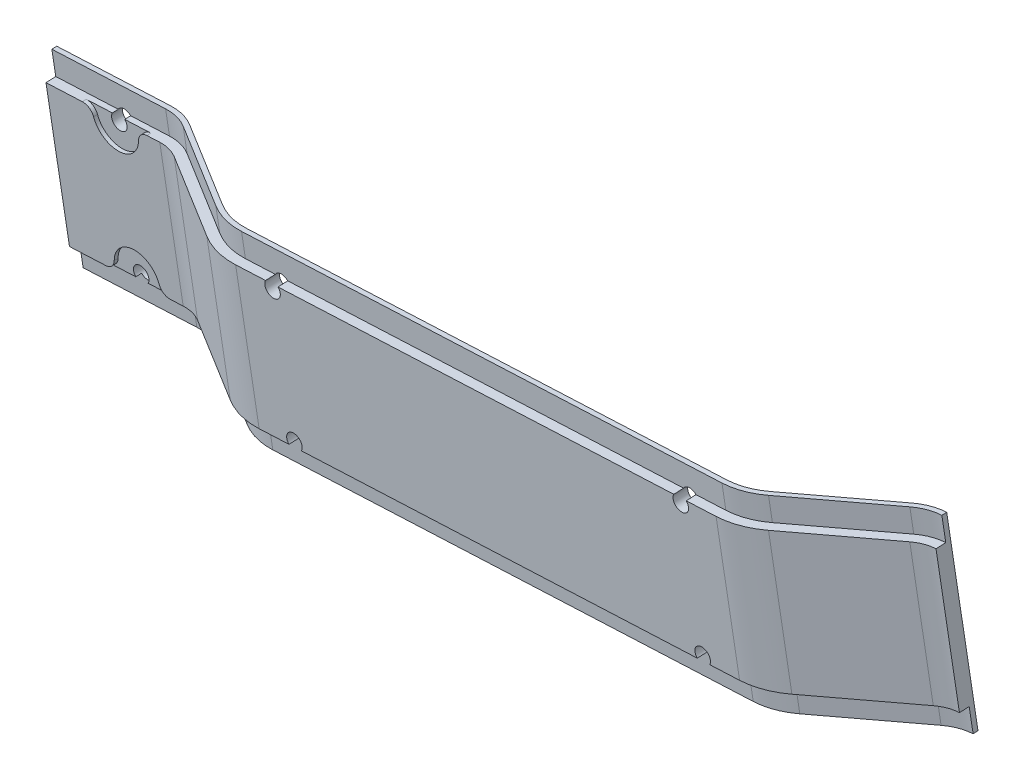
from build123d import *

# Parameters (mm, degrees)
EXTRUDE_1_DEPTH          = 40
CUT_EXTRUDE_1_DEPTH      = 5
SKETCH_5_R               = 1.7
CUT_EXTRUDE_2_DEPTH      = 10
SKETCH_6_R               = 1.7
CUT_EXTRUDE_3_DEPTH      = 55
CUT_EXTRUDE_4_DEPTH      = 0.8
EXTRUDE_2_DEPTH          = 2.5
EXTRUDE_3_DEPTH          = 2.5
MIRROR_3_COPY_1_DEPTH    = 5
MIRROR_3_COPY_2_SKETCH_R = 1.7
MIRROR_3_COPY_2_DEPTH    = 10
MIRROR_3_COPY_3_SKETCH_R = 1.7
MIRROR_3_COPY_3_DEPTH    = 55
MIRROR_3_COPY_4_DEPTH    = 0.8
CUT_EXTRUDE_5_DEPTH      = 67.5
FILLET_1_R               = 2.2


with BuildPart() as part:
    # 草图2 → 凸台-拉伸1 (new body)
    with BuildSketch(Plane(origin=(-35.952826641, 399.742426838, 30.566209897), x_dir=(0.9960030029050828, 0.08905977205298463, 0.006809934355634681), z_dir=(-0.0893197525973826, 0.9931039643902263, 0.07593745919082848))):
        with BuildLine():
            Line((491.263498397, -1135.802558188), (472.386322368, -1123.995822535))
            ThreePointArc((472.386322368, -1123.995822535), (468.823787584, -1122.370484391), (464.961974763, -1121.722580153))
            Line((464.961974763, -1121.722580153), (358.524587644, -1117.9611899))
            ThreePointArc((358.524587644, -1117.9611899), (354.626672948, -1118.33487317), (350.95829282, -1119.704678051))
            Line((350.95829282, -1119.704678051), (331.294771795, -1130.149424217))
            ThreePointArc((331.294771795, -1130.149424217), (328.360067693, -1131.245268121), (325.241735936, -1131.544214737))
            Line((325.241735936, -1131.544214737), (302.539273232, -1130.741932529))
            Line((302.539273232, -1130.741932529), (302.645224079, -1127.743804043))
            Line((302.645224079, -1127.743804043), (325.347686782, -1128.546086251))
            ThreePointArc((325.347686782, -1128.546086251), (327.6864356, -1128.321876289), (329.887463677, -1127.499993361))
            Line((329.887463677, -1127.499993361), (349.550984702, -1117.055247195))
            ThreePointArc((349.550984702, -1117.055247195), (353.953040855, -1115.411481338), (358.630538491, -1114.963061414))
            Line((358.630538491, -1114.963061414), (465.067925609, -1118.724451667))
            ThreePointArc((465.067925609, -1118.724451667), (469.702100995, -1119.501936753), (473.977142736, -1121.452342526))
            Line((473.977142736, -1121.452342526), (492.854318764, -1133.259078179))
            ThreePointArc((492.854318764, -1133.259078179), (494.991839635, -1134.234281065), (497.308927327, -1134.623023608))
            Line((497.308927327, -1134.623023608), (497.202976481, -1137.621152094))
            ThreePointArc((497.202976481, -1137.621152094), (494.113526224, -1137.102828703), (491.263498397, -1135.802558188))
        make_face()
    extrude_1 = extrude(amount=-EXTRUDE_1_DEPTH)

    # 草图3 → 切除-拉伸1 (cut)
    with BuildSketch(Plane(origin=(-35.952826641, 399.742426838, 30.566209897), x_dir=(0.9960030029050828, 0.08905977205298465, 0.0068099343556346816), z_dir=(-0.08931975259738263, 0.9931039643902263, 0.07593745919082849))):
        with BuildLine():
            Line((472.916595824, -1123.147995866), (491.793771852, -1134.954731518))
            ThreePointArc((491.793771852, -1134.954731518), (494.406297361, -1136.146646157), (497.23829343, -1136.621775932))
            Line((497.23829343, -1136.621775932), (497.308927327, -1134.623023608))
            ThreePointArc((497.308927327, -1134.623023608), (494.991839635, -1134.234281065), (492.854318764, -1133.259078179))
            Line((492.854318764, -1133.259078179), (473.977142736, -1121.452342526))
            ThreePointArc((473.977142736, -1121.452342526), (469.702100995, -1119.501936753), (465.067925609, -1118.724451667))
            Line((465.067925609, -1118.724451667), (358.630538491, -1114.963061414))
            ThreePointArc((358.630538491, -1114.963061414), (353.953040855, -1115.411481338), (349.550984702, -1117.055247195))
            Line((349.550984702, -1117.055247195), (329.887463677, -1127.499993361))
            ThreePointArc((329.887463677, -1127.499993361), (327.6864356, -1128.321876289), (325.347686782, -1128.546086251))
            Line((325.347686782, -1128.546086251), (302.645224079, -1127.743804043))
            Line((302.645224079, -1127.743804043), (302.574590181, -1129.742556367))
            Line((302.574590181, -1129.742556367), (325.277052884, -1130.544838575))
            ThreePointArc((325.277052884, -1130.544838575), (328.135523662, -1130.270804177), (330.825669089, -1129.266280598))
            Line((330.825669089, -1129.266280598), (350.489190114, -1118.821534432))
            ThreePointArc((350.489190114, -1118.821534432), (354.402128917, -1117.360409226), (358.559904593, -1116.961813738))
            Line((358.559904593, -1116.961813738), (464.997291711, -1120.723203991))
            ThreePointArc((464.997291711, -1120.723203991), (469.116558721, -1121.414301845), (472.916595824, -1123.147995866))
        make_face()
    cut_extrude_1 = extrude(amount=-CUT_EXTRUDE_1_DEPTH, mode=Mode.SUBTRACT)

    # 草图5 → 切除-拉伸2 (cut)
    with BuildSketch(Plane(origin=(-38.749709269, -87.401035492, 1097.445204006), x_dir=(-0.9993811405079085, 0.002792573598671191, -0.035064761938564566), z_dir=(0.03517578708589478, 0.07933995566829587, -0.9962267991965689))):
        with Locations(Location((-458.862769919, 439.287104682, 0), (0, 0, 138.840464963))):
            Circle(SKETCH_5_R)
        with Locations(Location((-368.721134255, 431.198319312, 0), (0, 0, 138.840464963))):
            Circle(SKETCH_5_R)
    cut_extrude_2 = extrude(amount=-CUT_EXTRUDE_2_DEPTH, mode=Mode.SUBTRACT)

    # 草图6 → 切除-拉伸3 (cut)
    with BuildSketch(Plane(origin=(-39.374079489, -88.809319705, 1115.128229692), x_dir=(0.9993811405079085, -0.0027925735986713165, 0.03506476193856587), z_dir=(-0.03517578708589609, -0.07933995566829595, 0.9962267991965689))):
        with Locations(Location((318.14198563, 426.659641103, 0), (0, 0, 270))):
            Circle(SKETCH_6_R)
    cut_extrude_3 = extrude(amount=-CUT_EXTRUDE_3_DEPTH, mode=Mode.SUBTRACT)

    # 草图7 → 切除-拉伸4 (cut)
    with BuildSketch(Plane(origin=(-39.268552128, -88.571299838, 1112.139549295), x_dir=(-0.999381140507908, 0.0027925735986721626, -0.035064761938575745), z_dir=(0.035175787085906, 0.0793399556682968, -0.9962267991965683))):
        with BuildLine():
            Line((-323.171775738, 427.110985172), (-323.082400675, 428.106983214))
            Line((-323.082400675, 428.106983214), (-313.022820459, 427.204295075))
            Line((-313.022820459, 427.204295075), (-313.112195522, 426.208297034))
            ThreePointArc((-313.112195522, 426.208297034), (-318.5933297, 421.629850995), (-323.171775738, 427.110985172))
        make_face()
    cut_extrude_4 = extrude(amount=-CUT_EXTRUDE_4_DEPTH, mode=Mode.SUBTRACT)

    # 镜向2: 切除-拉伸1, 切除-拉伸2, 切除-拉伸3, 切除-拉伸4 across plane
    add(cut_extrude_1.mirror(Plane(origin=(-34.166431589, 379.88034755, 29.047460713), x_dir=(0.006802356310068284, -0.07563217342500189, 0.9971125825560729), z_dir=(-0.08931975259738496, 0.9931039643902261, 0.07593745919082813))), mode=Mode.SUBTRACT)
    add(cut_extrude_2.mirror(Plane(origin=(-34.166431589, 379.88034755, 29.047460713), x_dir=(0.006802356310068284, -0.07563217342500189, 0.9971125825560729), z_dir=(-0.08931975259738496, 0.9931039643902261, 0.07593745919082813))), mode=Mode.SUBTRACT)
    add(cut_extrude_3.mirror(Plane(origin=(-34.166431589, 379.88034755, 29.047460713), x_dir=(0.006802356310068284, -0.07563217342500189, 0.9971125825560729), z_dir=(-0.08931975259738496, 0.9931039643902261, 0.07593745919082813))), mode=Mode.SUBTRACT)
    add(cut_extrude_4.mirror(Plane(origin=(-34.166431589, 379.88034755, 29.047460713), x_dir=(0.006802356310068284, -0.07563217342500189, 0.9971125825560729), z_dir=(-0.08931975259738496, 0.9931039643902261, 0.07593745919082813))), mode=Mode.SUBTRACT)

    # 草图8 → 凸台-拉伸2 (add)
    with BuildSketch(Plane(origin=(340.704104126, 29.543146934, 14.382756021), x_dir=(-0.041862751009763305, -0.0036300044207878395, 0.9991167765310518), z_dir=(-0.9953816583596617, -0.08631157133877967, -0.042019838816925247))):
        Polygon((1141.055755342, 281.607292025), (1143.049970278, 281.455282848), (1142.669947337, 276.469745508), (1143.667054805, 276.39374092), (1146.707238334, 316.278039637), (1145.710130866, 316.354044225), (1145.330107925, 311.368506885), (1143.335892989, 311.520516062), align=None)
    extrude_2 = extrude(amount=EXTRUDE_2_DEPTH)

    # 草图9 → 凸台-拉伸3 (add)
    with BuildSketch(Plane(origin=(-38.85523663, -87.639055359, 1100.433884404), x_dir=(0.9993811405079085, -0.0027925735986713833, 0.03506476193856667), z_dir=(-0.03517578708589689, -0.07933995566829606, 0.9962267991965688))):
        with BuildLine():
            Line((435.897838743, 429.294623007), (446.52847555, 414.184265816))
            ThreePointArc((446.52847555, 414.184265816), (448.038117239, 412.923247058), (449.976014672, 412.585993624))
            Line((449.976014672, 412.585993624), (452.276173621, 412.792396491))
            ThreePointArc((452.276173621, 412.792396491), (455.384087503, 414.978916855), (455.044462263, 418.763709412))
            Line((455.044462263, 418.763709412), (444.413825456, 433.874066602))
            ThreePointArc((444.413825456, 433.874066602), (442.904183767, 435.13508536), (440.966286334, 435.472338795))
            Line((440.966286334, 435.472338795), (438.666127385, 435.265935927))
            ThreePointArc((438.666127385, 435.265935927), (435.558213503, 433.079415563), (435.897838743, 429.294623007))
        make_face()
        with BuildLine():
            Line((415.612540389, 427.474338481), (426.243177196, 412.36398129))
            ThreePointArc((426.243177196, 412.36398129), (427.752818885, 411.102962532), (429.690716318, 410.765709098))
            Line((429.690716318, 410.765709098), (431.990875267, 410.972111965))
            ThreePointArc((431.990875267, 410.972111965), (435.098789149, 413.158632329), (434.759163908, 416.943424886))
            Line((434.759163908, 416.943424886), (424.128527102, 432.053782076))
            ThreePointArc((424.128527102, 432.053782076), (422.618885413, 433.314800834), (420.68098798, 433.652054268))
            Line((420.68098798, 433.652054268), (418.380829031, 433.445651401))
            ThreePointArc((418.380829031, 433.445651401), (415.272915149, 431.259131037), (415.612540389, 427.474338481))
        make_face()
        with BuildLine():
            Line((395.327242035, 425.654053954), (405.957878841, 410.543696764))
            ThreePointArc((405.957878841, 410.543696764), (407.467520531, 409.282678006), (409.405417964, 408.945424572))
            Line((409.405417964, 408.945424572), (411.705576912, 409.151827439))
            ThreePointArc((411.705576912, 409.151827439), (414.813490794, 411.338347803), (414.473865554, 415.123140359))
            Line((414.473865554, 415.123140359), (403.843228748, 430.23349755))
            ThreePointArc((403.843228748, 430.23349755), (402.333587058, 431.494516308), (400.395689626, 431.831769742))
            Line((400.395689626, 431.831769742), (398.095530677, 431.625366875))
            ThreePointArc((398.095530677, 431.625366875), (394.987616795, 429.438846511), (395.327242035, 425.654053954))
        make_face()
        with BuildLine():
            Line((375.041943681, 423.833769428), (385.672580487, 408.723412238))
            ThreePointArc((385.672580487, 408.723412238), (387.182222177, 407.46239348), (389.120119609, 407.125140045))
            Line((389.120119609, 407.125140045), (391.420278558, 407.331542913))
            ThreePointArc((391.420278558, 407.331542913), (394.52819244, 409.518063277), (394.1885672, 413.302855833))
            Line((394.1885672, 413.302855833), (383.557930394, 428.413213024))
            ThreePointArc((383.557930394, 428.413213024), (382.048288704, 429.674231782), (380.110391271, 430.011485216))
            Line((380.110391271, 430.011485216), (377.810232323, 429.805082349))
            ThreePointArc((377.810232323, 429.805082349), (374.702318441, 427.618561985), (375.041943681, 423.833769428))
        make_face()
    extrude_3 = extrude(amount=EXTRUDE_3_DEPTH)

    # 镜向3: 凸台-拉伸1, 切除-拉伸1, 切除-拉伸2, 切除-拉伸3, 切除-拉伸4, 凸台-拉伸2, 凸台-拉伸3 across plane
    add(extrude_1.mirror(Plane(origin=(448.307820102, 121.804543781, 1131.303953203), x_dir=(0.9993811405079085, -0.0027925735986710416, 0.035064761938562554), z_dir=(0.03517578708589275, 0.07933995566829571, -0.996226799196569))))
    add(cut_extrude_1.mirror(Plane(origin=(448.307820102, 121.804543781, 1131.303953203), x_dir=(0.9993811405079085, -0.0027925735986710416, 0.035064761938562554), z_dir=(0.03517578708589275, 0.07933995566829571, -0.996226799196569))), mode=Mode.SUBTRACT)
    add(cut_extrude_2.mirror(Plane(origin=(448.307820102, 121.804543781, 1131.303953203), x_dir=(0.9993811405079085, -0.0027925735986710416, 0.035064761938562554), z_dir=(0.03517578708589275, 0.07933995566829571, -0.996226799196569))), mode=Mode.SUBTRACT)
    add(cut_extrude_3.mirror(Plane(origin=(448.307820102, 121.804543781, 1131.303953203), x_dir=(0.9993811405079085, -0.0027925735986710416, 0.035064761938562554), z_dir=(0.03517578708589275, 0.07933995566829571, -0.996226799196569))), mode=Mode.SUBTRACT)
    add(cut_extrude_4.mirror(Plane(origin=(448.307820102, 121.804543781, 1131.303953203), x_dir=(0.9993811405079085, -0.0027925735986710416, 0.035064761938562554), z_dir=(0.03517578708589275, 0.07933995566829571, -0.996226799196569))), mode=Mode.SUBTRACT)
    add(extrude_2.mirror(Plane(origin=(448.307820102, 121.804543781, 1131.303953203), x_dir=(0.9993811405079085, -0.0027925735986710416, 0.035064761938562554), z_dir=(0.03517578708589275, 0.07933995566829571, -0.996226799196569))))
    add(extrude_3.mirror(Plane(origin=(448.307820102, 121.804543781, 1131.303953203), x_dir=(0.9993811405079085, -0.0027925735986710416, 0.035064761938562554), z_dir=(0.03517578708589275, 0.07933995566829571, -0.996226799196569))))

    # 镜向3 copy 1 sketch → 镜向3 copy 1 (cut)
    with BuildSketch(Plane(origin=(-109.879455074, 185.216197279, 2222.419119542), x_dir=(0.9935183999601052, 0.08345568174432164, 0.07717731613176906), z_dir=(0.08931975259738736, -0.9931039643902263, -0.07593745919082881))):
        with BuildLine():
            Line((472.916595824, -1123.147995866), (491.793771852, -1134.954731518))
            ThreePointArc((491.793771852, -1134.954731518), (494.406297361, -1136.146646157), (497.23829343, -1136.621775932))
            Line((497.23829343, -1136.621775932), (497.308927327, -1134.623023608))
            ThreePointArc((497.308927327, -1134.623023608), (494.991839635, -1134.234281065), (492.854318764, -1133.259078179))
            Line((492.854318764, -1133.259078179), (473.977142736, -1121.452342526))
            ThreePointArc((473.977142736, -1121.452342526), (469.702100995, -1119.501936753), (465.067925609, -1118.724451667))
            Line((465.067925609, -1118.724451667), (358.630538491, -1114.963061414))
            ThreePointArc((358.630538491, -1114.963061414), (353.953040855, -1115.411481338), (349.550984702, -1117.055247195))
            Line((349.550984702, -1117.055247195), (329.887463677, -1127.499993361))
            ThreePointArc((329.887463677, -1127.499993361), (327.6864356, -1128.321876289), (325.347686782, -1128.546086251))
            Line((325.347686782, -1128.546086251), (302.645224079, -1127.743804043))
            Line((302.645224079, -1127.743804043), (302.574590181, -1129.742556367))
            Line((302.574590181, -1129.742556367), (325.277052884, -1130.544838575))
            ThreePointArc((325.277052884, -1130.544838575), (328.135523662, -1130.270804177), (330.825669089, -1129.266280598))
            Line((330.825669089, -1129.266280598), (350.489190114, -1118.821534432))
            ThreePointArc((350.489190114, -1118.821534432), (354.402128917, -1117.360409226), (358.559904593, -1116.961813738))
            Line((358.559904593, -1116.961813738), (464.997291711, -1120.723203991))
            ThreePointArc((464.997291711, -1120.723203991), (469.116558721, -1121.414301845), (472.916595824, -1123.147995866))
        make_face()
    extrude(amount=-MIRROR_3_COPY_1_DEPTH, mode=Mode.SUBTRACT)

    # 镜向3 copy 2 sketch → 镜向3 copy 2 (cut)
    with BuildSketch(Plane(origin=(-107.082572446, 672.359659609, 1155.540125432), x_dir=(-0.9834152234404653, -0.174724885571583, -0.04863859236796345), z_dir=(-0.0351757870858907, -0.07933995566829603, 0.9962267991965693))):
        with Locations(Location((-458.862769919, 439.287104682, 0), (0, 0, 138.840464963))):
            Circle(MIRROR_3_COPY_2_SKETCH_R)
        with Locations(Location((-368.721134255, 431.198319312, 0), (0, 0, 138.840464963))):
            Circle(MIRROR_3_COPY_2_SKETCH_R)
    extrude(amount=-MIRROR_3_COPY_2_DEPTH, mode=Mode.SUBTRACT)

    # 镜向3 copy 3 sketch → 镜向3 copy 3 (cut)
    with BuildSketch(Plane(origin=(-106.458202225, 673.767943822, 1137.857099747), x_dir=(0.9834152234404654, 0.17472488557158314, 0.048638592367962155), z_dir=(0.03517578708588941, 0.0793399556682959, -0.9962267991965694))):
        with Locations(Location((318.14198563, 426.659641103, 0), (0, 0, 270))):
            Circle(MIRROR_3_COPY_3_SKETCH_R)
    extrude(amount=-MIRROR_3_COPY_3_DEPTH, mode=Mode.SUBTRACT)

    # 镜向3 copy 4 sketch → 镜向3 copy 4 (cut)
    with BuildSketch(Plane(origin=(-106.563729587, 673.529923955, 1140.845780144), x_dir=(-0.9834152234404656, -0.17472488557158397, -0.04863859236795228), z_dir=(-0.035175787085879484, -0.07933995566829502, 0.9962267991965696))):
        with BuildLine():
            Line((-323.171775738, 427.110985172), (-323.082400675, 428.106983214))
            Line((-323.082400675, 428.106983214), (-313.022820459, 427.204295075))
            Line((-313.022820459, 427.204295075), (-313.112195522, 426.208297034))
            ThreePointArc((-313.112195522, 426.208297034), (-318.5933297, 421.629850995), (-323.171775738, 427.110985172))
        make_face()
    extrude(amount=-MIRROR_3_COPY_4_DEPTH, mode=Mode.SUBTRACT)

    # 草图10 → 切除-拉伸5 (cut, symmetric)
    with BuildSketch(Plane(origin=(-35.952826641, 399.742426838, 30.566209897), x_dir=(0.9960030029050828, 0.08905977205298465, 0.006809934355634687), z_dir=(-0.08931975259738263, 0.9931039643902263, 0.0759374591908285))):
        Polygon((281.909239041, -1112.251807825), (520.448071055, -1120.68153033), (520.448071055, -1155.380902281), (280.684527596, -1146.907899704), align=None)
    extrude(amount=CUT_EXTRUDE_5_DEPTH, both=True, mode=Mode.SUBTRACT)

    # 圆角1
    # the kernel refuses this fillet: 2.2 mm, written as the material it adds along each edge
    # the kernel refuses this fillet: 2.2 mm, written as the material it takes off along each edge
    with BuildSketch(Plane(origin=(274.413564024, 338.334467283, 1132.872478769), x_dir=(-0.9953816583596637, -0.08631157133876392, -0.04201983881691156), z_dir=(0.03517578708587951, 0.0793399556682946, -0.9962267991965695))) as fillet_1_2_piece_1:
        with BuildLine():
            CenterArc((2.1, -2.2), FILLET_1_R, 90, 80.472716619)
            Line((-0.069655172, -1.835862069), (-0.28662069, -1.799448276))
            ThreePointArc((-0.28662069, -1.799448276), (-0.22, -1), (-0.22, 0))
            Line((-0.22, 0), (0, 0.22))
            Line((0, 0.22), (2.1, 0.22))
            Line((2.1, 0.22), (2.1, 0))
        make_face()
    extrude(amount=6.05, mode=Mode.SUBTRACT)
    with BuildSketch(Plane(origin=(284.466918773, 339.206214153, 1133.296879141), x_dir=(0.995381658359662, 0.08631157133878167, 0.04201983881691291), z_dir=(0.03517578708587951, 0.0793399556682946, -0.9962267991965695))) as fillet_1_2_piece_2:
        with BuildLine():
            CenterArc((2.1, 2.2), FILLET_1_R, 189.527283381, 80.472716619)
            Line((-0.069655172, 1.835862069), (-0.28662069, 1.799448276))
            ThreePointArc((-0.28662069, 1.799448276), (-0.22, 1), (-0.22, 0))
            Line((-0.22, 0), (0, -0.22))
            Line((0, -0.22), (2.1, -0.22))
            Line((2.1, -0.22), (2.1, 0))
        make_face()
    extrude(amount=6.05, mode=Mode.SUBTRACT)
    with BuildSketch(Plane(origin=(287.146511351, 309.413095221, 1131.018755365), x_dir=(-0.12699454910091193, 0.9891174969242452, 0.07428971514935175), z_dir=(0.03517578708587948, 0.079339955668295, -0.9962267991965694))) as fillet_1_2_piece_3:
        with BuildLine():
            CenterArc((2.118798556, 2.181901162), FILLET_1_R, 182.172839706, 80.472716619)
            Line((-0.079619647, 2.098490103), (-0.299461467, 2.090148997))
            Line((-0.299461467, 2.090148997), (-0.21984182, -0.008341106))
            Line((-0.21984182, -0.008341106), (0.008341106, -0.21984182))
            ThreePointArc((0.008341106, -0.21984182), (1.007622107, -0.181927703), (1.809021446, -0.218190116))
            Line((1.809021446, -0.218190116), (1.837183001, 0))
        make_face()
    extrude(amount=6.05, mode=Mode.SUBTRACT)
    with BuildSketch(Plane(origin=(277.093156602, 308.541348351, 1130.594354993), x_dir=(-0.051516514533048556, 0.9956623510617543, 0.07747600537292855), z_dir=(0.03517578708587948, 0.079339955668295, -0.9962267991965694))) as fillet_1_2_piece_4:
        with BuildLine():
            CenterArc((2.118798556, -2.181901162), FILLET_1_R, 97.354443676, 80.472716619)
            Line((-0.079619647, -2.098490103), (-0.299461467, -2.090148997))
            Line((-0.299461467, -2.090148997), (-0.21984182, 0.008341106))
            Line((-0.21984182, 0.008341106), (0.008341106, 0.21984182))
            ThreePointArc((0.008341106, 0.21984182), (1.007622107, 0.181927703), (1.809021446, 0.218190116))
            Line((1.809021446, 0.218190116), (1.837183001, 0))
        make_face()
    extrude(amount=6.05, mode=Mode.SUBTRACT)


solid = part.part
